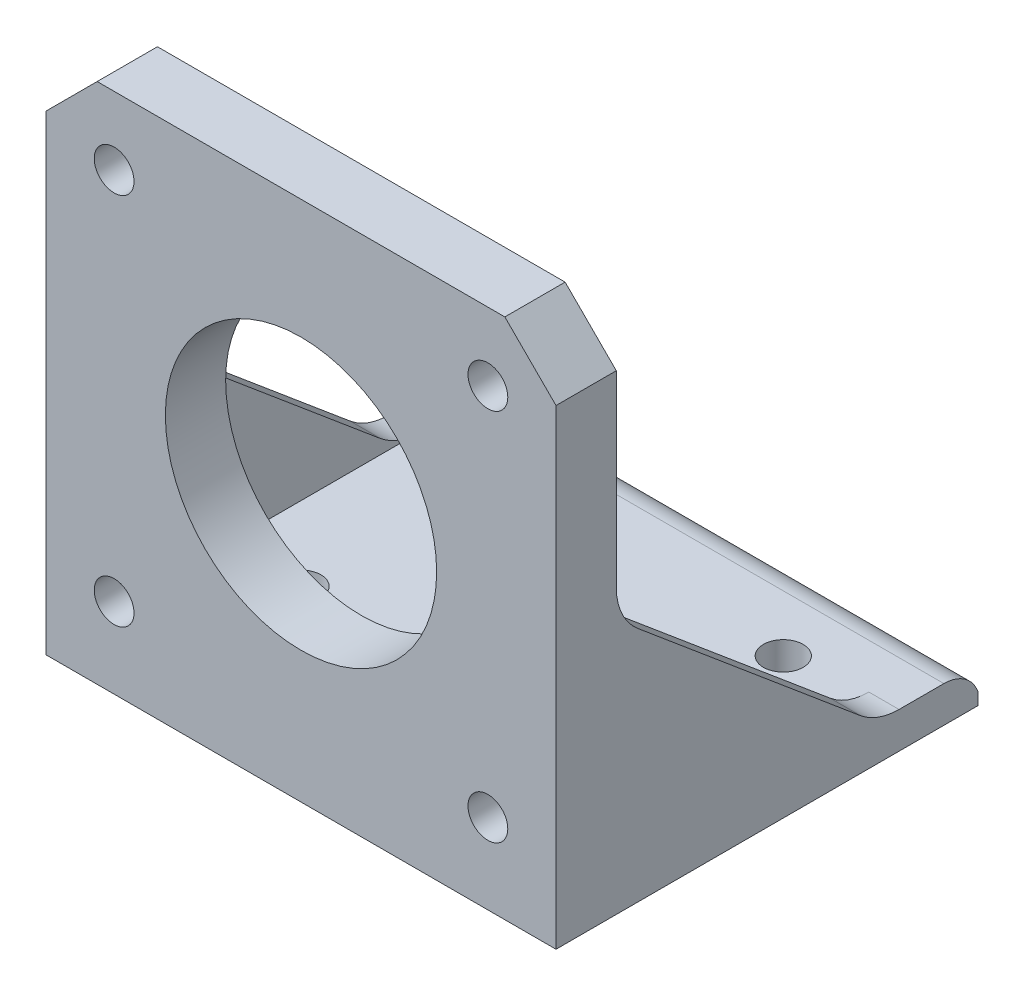
from build123d import *
from build123d.topology import SkipClean

# Parameters (mm, degrees)
SKETCH2_R           = 1.65
SKETCH2_R_2         = 11.25
BOSS_EXTRUDE2_DEPTH = 2.5
SKETCH7_W           = 42.3
SKETCH7_H           = 35
BOSS_EXTRUDE5_DEPTH = 2
BOSS_EXTRUDE6_DEPTH = 2.5
FILLET2_R           = 5
FILLET3_R           = 3
SKETCH11_R          = 1.65
CUT_EXTRUDE1_DEPTH  = 2
SKETCH12_W          = 42.3
SKETCH12_H          = 35
SKETCH12_R          = 1.65
BOSS_EXTRUDE7_DEPTH = 1


with BuildPart() as part:
    # Sketch2 → Boss-Extrude2 (new, symmetric)
    with BuildSketch(Plane.XY):
        Polygon((-21.15, 16.907359313), (-16.907359313, 21.15), (16.907359313, 21.15), (21.15, 16.907359313), (21.15, -16.907359313), (21.15, -21.15), (16.907359313, -21.15), (-16.907359313, -21.15), (-21.15, -21.15), (-21.15, -16.907359313), align=None)
        with Locations((-15.5, 15.5)):
            Circle(SKETCH2_R, mode=Mode.SUBTRACT)
        Circle(SKETCH2_R_2, mode=Mode.SUBTRACT)
        with Locations((15.5, 15.5)):
            Circle(SKETCH2_R, mode=Mode.SUBTRACT)
        with Locations((15.5, -15.5)):
            Circle(SKETCH2_R, mode=Mode.SUBTRACT)
        with Locations((-15.5, -15.5)):
            Circle(SKETCH2_R, mode=Mode.SUBTRACT)
    extrude(amount=BOSS_EXTRUDE2_DEPTH, both=True)

    # Sketch7 → Boss-Extrude5 (add)
    with BuildSketch(Plane.XZ.offset(21.15)):
        with Locations((0, -15)):
            Rectangle(SKETCH7_W, SKETCH7_H)
    extrude(amount=-BOSS_EXTRUDE5_DEPTH)

    # Sketch10 → Boss-Extrude6 (add)
    with BuildSketch(Plane(origin=(21.15, 0, 0), x_dir=(0, 0, -1), z_dir=(1, 0, 0))):
        Polygon((24.130327706, -19.15), (2.5, -1), (2.5, -19.15), align=None)
    boss_extrude6 = extrude(amount=-BOSS_EXTRUDE6_DEPTH)

    # Mirror2: Boss-Extrude6 across plane
    add(boss_extrude6.mirror(Plane(origin=(0, 0, 0), x_dir=(0, 0, 1), z_dir=(1, 0, 0))))

    # Fillet2
    fillet2_edges = [part.edges().sort_by_distance(p)[0] for p in [
        (19.9, -19.15, -24.130327706),
        (19.9, -1, -2.5),
        (-19.9, -19.15, -24.130327706),
        (-19.9, -1, -2.5),
    ]]
    fillet(fillet2_edges, radius=FILLET2_R)

    # Fillet3
    # the kernel refuses this fillet: 3 mm, written as the material it takes off along each edge
    with BuildSketch(Plane(origin=(-28.221067812, -19.15, -32.5), x_dir=(0, -1, 0), z_dir=(1, 0, 0))) as fillet3_piece_1:
        with BuildLine():
            CenterArc((3, -2.828427125), FILLET3_R, 109.471220634, 70.528779366)
            Line((0, -2.828427125), (-0.06, -2.828427125))
            Line((-0.06, -2.828427125), (-0.06, 0))
            Line((-0.06, 0), (0, 0.06))
            ThreePointArc((0, 0.06), (1, 0.06), (1.98, 0.056568542))
            Line((1.98, 0.056568542), (2, 0))
        make_face()
    extrude(amount=56.442135624, mode=Mode.SUBTRACT)

    # Sketch11 → Cut-Extrude1 (cut)
    with BuildSketch(Plane(origin=(0, -19.15, 0), x_dir=(1, 0, 0), z_dir=(0, 1, 0))):
        with Locations(Location((12.5, 10, 0), (0, 0, 270))):
            Circle(SKETCH11_R)
        with Locations(Location((12.5, 25, 0), (0, 0, 270))):
            Circle(SKETCH11_R)
        with Locations(Location((-12.5, 25, 0), (0, 0, 270))):
            Circle(SKETCH11_R)
        with Locations(Location((-12.5, 10, 0), (0, 0, 270))):
            Circle(SKETCH11_R)
    extrude(amount=-CUT_EXTRUDE1_DEPTH, mode=Mode.SUBTRACT)

    # Sketch12 → Boss-Extrude7 (add)
    with SkipClean():  # the faces are left unmerged after this step: merging them gives an invalid solid
        with BuildSketch(Plane.XZ.offset(21.15)):
            with Locations((0, -15)):
                Rectangle(SKETCH12_W, SKETCH12_H)
            with Locations(Location((-12.5, -25, 0), (0, 0, 270))):
                Circle(SKETCH12_R, mode=Mode.SUBTRACT)
            with Locations(Location((-12.5, -10, 0), (0, 0, 270))):
                Circle(SKETCH12_R, mode=Mode.SUBTRACT)
            with Locations(Location((12.5, -10, 0), (0, 0, 90))):
                Circle(SKETCH12_R, mode=Mode.SUBTRACT)
            with Locations(Location((12.5, -25, 0), (0, 0, 90))):
                Circle(SKETCH12_R, mode=Mode.SUBTRACT)
        extrude(amount=BOSS_EXTRUDE7_DEPTH)
    add(part.part.scale(1), mode=Mode.REPLACE)  # the faces are merged on a copy


solid = part.part
